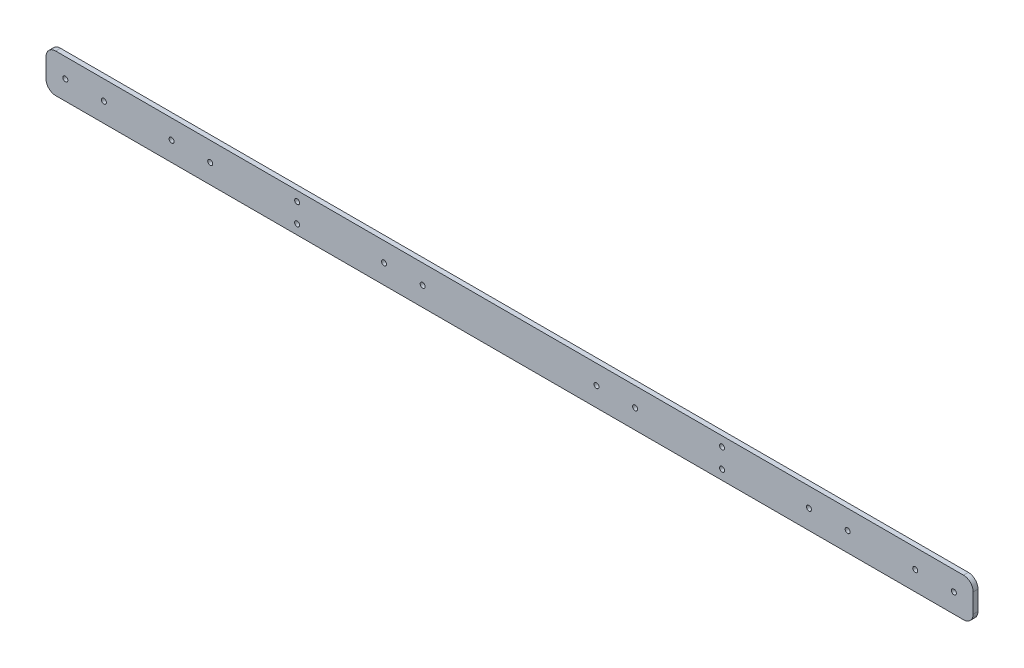
from build123d import *

# Parameters (mm, degrees)
SKETCH2_R           = 1.6383
BOSS_EXTRUDE1_DEPTH = 3.175
SKETCH5_R           = 1.6383
CUT_EXTRUDE1_DEPTH  = 306.080990271


with BuildPart() as part:
    # Sketch2 → Boss-Extrude1 (new body)
    with BuildSketch(Plane.XY):
        with BuildLine():
            Line((-298.45, 12.7), (298.45, 12.7))
            ThreePointArc((298.45, 12.7), (302.940128061, 10.840128061), (304.8, 6.35))
            Line((304.8, 6.35), (304.8, -6.35))
            ThreePointArc((304.8, -6.35), (302.940128061, -10.840128061), (298.45, -12.7))
            Line((298.45, -12.7), (-298.45, -12.7))
            ThreePointArc((-298.45, -12.7), (-302.940128061, -10.840128061), (-304.8, -6.35))
            Line((-304.8, -6.35), (-304.8, 6.35))
            ThreePointArc((-304.8, 6.35), (-302.940128061, 10.840128061), (-298.45, 12.7))
        make_face()
        with Locations((-292.1, 0)):
            Circle(SKETCH2_R, mode=Mode.SUBTRACT)
        with Locations((-266.7, 0)):
            Circle(SKETCH2_R, mode=Mode.SUBTRACT)
        with Locations((292.1, 0)):
            Circle(SKETCH2_R, mode=Mode.SUBTRACT)
        with Locations((266.7, 0)):
            Circle(SKETCH2_R, mode=Mode.SUBTRACT)
    extrude(amount=BOSS_EXTRUDE1_DEPTH)

    # Sketch5 → Cut-Extrude1 (cut, through all)
    with BuildSketch(Plane.XY.offset(3.175)):
        with Locations((-222.25, 0)):
            Circle(SKETCH5_R)
        with Locations((-196.85, 0)):
            Circle(SKETCH5_R)
        with Locations((-82.55, 0)):
            Circle(SKETCH5_R)
        with Locations((-57.15, 0)):
            Circle(SKETCH5_R)
        with Locations((57.15, 0)):
            Circle(SKETCH5_R)
        with Locations((82.55, 0)):
            Circle(SKETCH5_R)
        with Locations((196.85, 0)):
            Circle(SKETCH5_R)
        with Locations((222.25, 0)):
            Circle(SKETCH5_R)
        with Locations((-139.7, 6.35)):
            Circle(SKETCH5_R)
        with Locations((-139.7, -6.35)):
            Circle(SKETCH5_R)
        with Locations((139.7, -6.35)):
            Circle(SKETCH5_R)
        with Locations((139.7, 6.35)):
            Circle(SKETCH5_R)
    extrude(amount=-CUT_EXTRUDE1_DEPTH, mode=Mode.SUBTRACT)


solid = part.part
